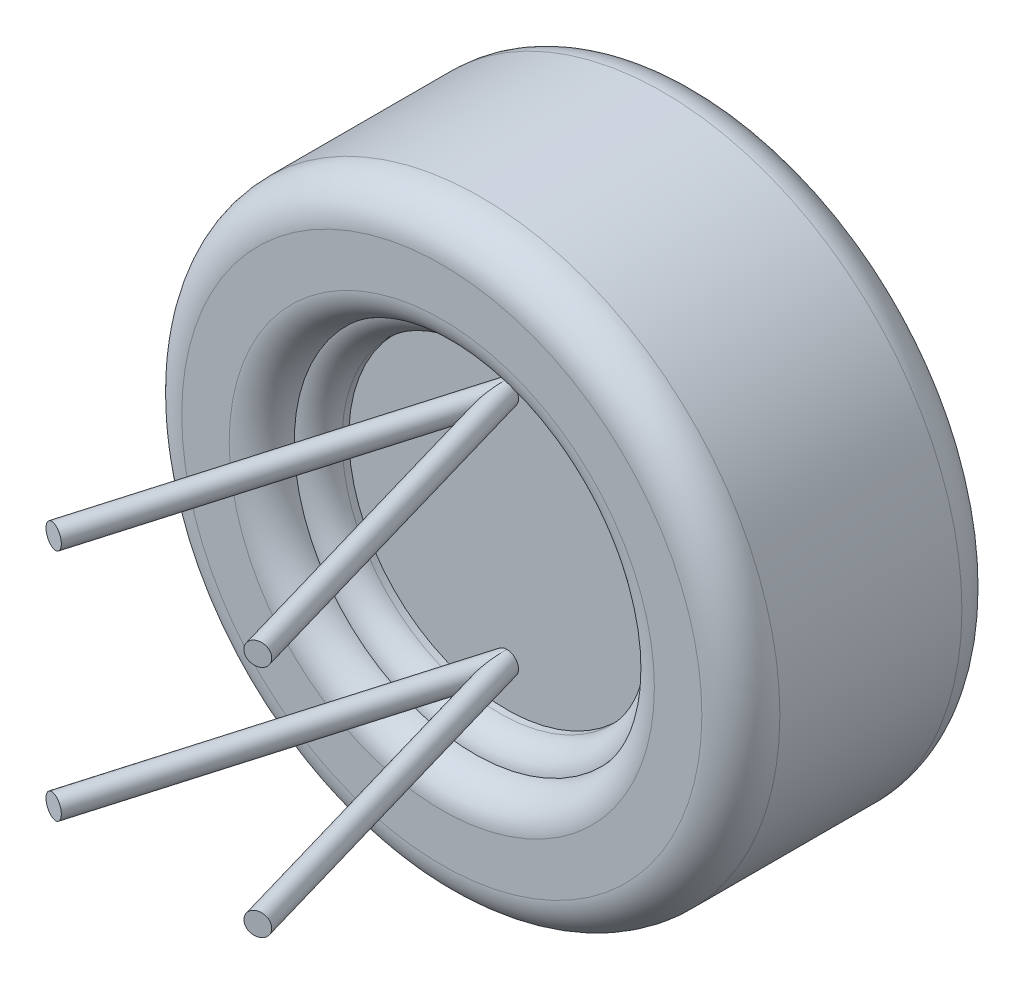
from build123d import *

# Parameters (mm, degrees)
SKETCH_1_R               = 230
EXTRUDE_1_DEPTH          = 200
SKETCH_4_R               = 138.5
CUT_EXTRUDE_1_DEPTH      = 25
SKETCH_5_R               = 121.5
CUT_EXTRUDE_2_DEPTH      = 25
SKETCH_6_R               = 131.5
CUT_EXTRUDE_3_DEPTH      = 25
FILLET_1_R               = 25
FILLET_2_R               = 20
FILLET_3_R               = 30
SKETCH_11_ON_SEGMENT_1_R = 8.65
F_17_3_CIRCLE_1_DEPTH    = 281.180102425
SKETCH_11_R              = 8.65
F_17_3_CIRCLE_1_2_DEPTH  = 281.180102425
SKETCH_12_ON_SEGMENT_1_R = 8.65
F_17_3_CIRCLE_2_DEPTH    = 281.180102425
SKETCH_12_R              = 8.65
F_17_3_CIRCLE_2_2_DEPTH  = 281.180102425
EXTRUDE_2_DEPTH          = 50
FILLET_5_R               = 3.5


# Some blends are built 0.0001 mm under size
with BuildPart() as part:
    # 스케치1 → 보스-돌출1 (new body)
    with BuildSketch(Plane.XY):
        Circle(SKETCH_1_R)
    extrude(amount=EXTRUDE_1_DEPTH)

    # 스케치4 → 컷-돌출1 (cut)
    with BuildSketch(Plane.XY.offset(200)):
        Circle(SKETCH_4_R)
    extrude(amount=-CUT_EXTRUDE_1_DEPTH, mode=Mode.SUBTRACT)

    # 스케치5 → 컷-돌출2 (cut)
    with BuildSketch(Plane.XY.offset(175)):
        Circle(SKETCH_5_R)
    extrude(amount=-CUT_EXTRUDE_2_DEPTH, mode=Mode.SUBTRACT)

    # 스케치6 → 컷-돌출3 (cut)
    with BuildSketch(Plane(origin=(0, 0, 0), x_dir=(-1, 0, 0), z_dir=(0, 0, -1))):
        Circle(SKETCH_6_R)
    extrude(amount=-CUT_EXTRUDE_3_DEPTH, mode=Mode.SUBTRACT)

    # 필렛1
    fillet_1_edges = [part.edges().sort_by_distance(p)[0] for p in [
        (131.5, 0, 0),
        (-138.5, 0, 200),
    ]]
    fillet(fillet_1_edges, radius=FILLET_1_R - 0.0001)  # a hair under: the kernel refuses the full size

    # 필렛2
    # the kernel refuses this fillet: 20 mm, written as the material it takes off along each edge
    with BuildSketch(Plane(origin=(0, 0, 175), x_dir=(1, 0, 0), z_dir=(0, -1, 0))) as fillet_2_piece_1:
        with BuildLine():
            CenterArc((141.5, -19.773719933), FILLET_2_R, 98.626926559, 81.373073441)
            Line((121.5, -19.773719933), (121.1, -19.773719933))
            Line((121.1, -19.773719933), (121.1, 0))
            Line((121.1, 0), (121.5, 0.4))
            ThreePointArc((121.5, 0.4), (130, 0.4), (138.44, 0.395474399))
            Line((138.44, 0.395474399), (138.5, 0))
        make_face()
    revolve(axis=Axis((0, 0, 175), (0, 0, 1)), mode=Mode.SUBTRACT)

    # 필렛3
    fillet_3_edges = [part.edges().sort_by_distance(p)[0] for p in [
        (-230, 0, 0),
        (-230, 0, 200),
    ]]
    fillet(fillet_3_edges, radius=FILLET_3_R)

    # 스케치16 → 보스-돌출2 (add, symmetric)
    with BuildSketch(Plane.XY.offset(100)):
        with BuildLine():
            Line((-50, -234.499443206), (50, -234.499443206))
            Line((50, -234.499443206), (50, -224.499443206))
            ThreePointArc((50, -224.499443206), (0, -230), (-50, -224.499443206))
            Line((-50, -224.499443206), (-50, -234.499443206))
        make_face()
    extrude(amount=EXTRUDE_2_DEPTH, both=True)

    # 필렛5
    fillet_5_edges = [part.edges().sort_by_distance(p)[0] for p in [
        (-50, -224.499443206, 100),
        (0, -230, 50),
        (50, -224.499443206, 100),
        (0, -230, 150),
    ]]
    fillet(fillet_5_edges, radius=FILLET_5_R)


with BuildPart() as body_2:
    # 스케치11 on segment 1 (carried to segment 1) → 종류 17.3_CIRCLE(1) (new body)
    with BuildSketch(Plane(origin=(78.5, 90, 420), x_dir=(-0.960238643, 0, 0.279180494), z_dir=(-0.279180494, 0, -0.960238643))):
        Circle(SKETCH_11_ON_SEGMENT_1_R)
    extrude(amount=F_17_3_CIRCLE_1_DEPTH)


with BuildPart() as body_3:
    # 스케치11 → 17.3_CIRCLE_1 2 (new body)
    with BuildSketch(Plane(origin=(0, 90, 150), x_dir=(0.9602386430297387, 0, 0.27918049436234993), z_dir=(-0.27918049436234993, 0, 0.9602386430297387))):
        Circle(SKETCH_11_R)
    extrude(amount=F_17_3_CIRCLE_1_2_DEPTH)


with BuildPart() as body_4:
    # 스케치12 on segment 1 (carried to segment 1) → 종류 17.3_CIRCLE(2) (new body)
    with BuildSketch(Plane(origin=(-78.5, -90, 420), x_dir=(-0.960238643, 0, -0.279180494), z_dir=(0.279180494, 0, -0.960238643))):
        Circle(SKETCH_12_ON_SEGMENT_1_R)
    extrude(amount=F_17_3_CIRCLE_2_DEPTH)


with BuildPart() as body_5:
    # 스케치12 → 17.3_CIRCLE_2 2 (new body)
    with BuildSketch(Plane(origin=(0, -90, 150), x_dir=(0.9602386430297387, 0, -0.27918049436234993), z_dir=(0.27918049436234993, 0, 0.9602386430297387))):
        Circle(SKETCH_12_R)
    extrude(amount=F_17_3_CIRCLE_2_2_DEPTH)


solid = Compound([part.part, body_2.part, body_3.part, body_4.part, body_5.part])
